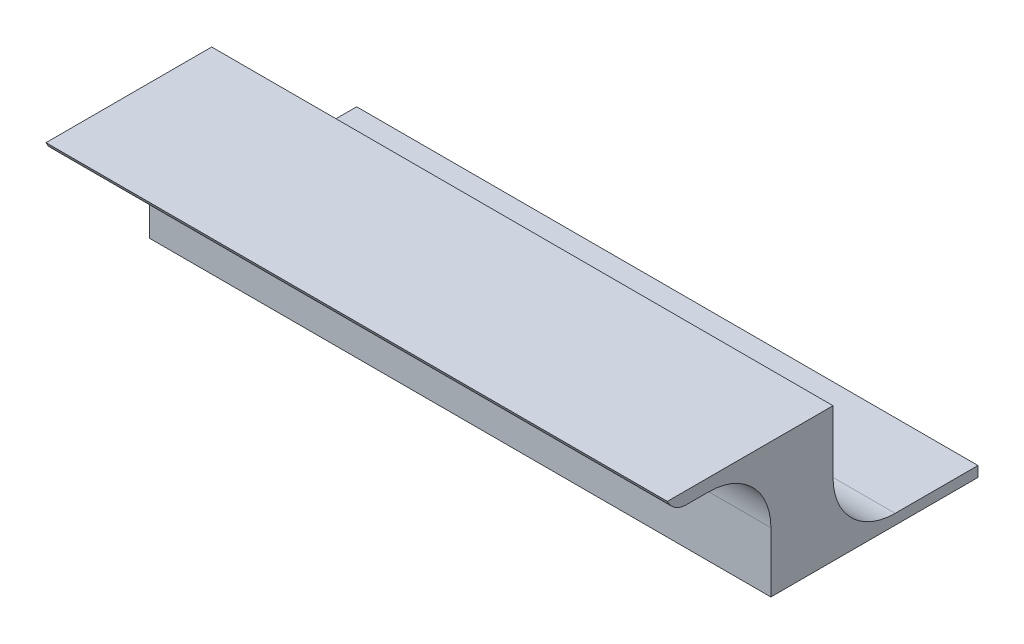
from build123d import *

# Parameters (mm, degrees)
SKETCH1_W           = 30
SKETCH1_H           = 10
BOSS_EXTRUDE1_DEPTH = 0.5
SKETCH2_W           = 30
SKETCH2_H           = 3
BOSS_EXTRUDE2_DEPTH = 6
SKETCH3_W           = 30
SKETCH3_H           = 0.6
BOSS_EXTRUDE3_DEPTH = 5
FILLET1_R           = 3
FILLET2_R           = 1


with BuildPart() as part:
    # Sketch1 → Boss-Extrude1 (new body)
    with BuildSketch(Plane(origin=(0, 0, 0), x_dir=(1, 0, 0), z_dir=(0, 1, 0))):
        Rectangle(SKETCH1_W, SKETCH1_H)
    extrude(amount=BOSS_EXTRUDE1_DEPTH)

    # Sketch2 → Boss-Extrude2 (add)
    with BuildSketch(Plane(origin=(0, 0.5, 0), x_dir=(1, 0, 0), z_dir=(0, 1, 0))):
        with Locations((0, -3.5)):
            Rectangle(SKETCH2_W, SKETCH2_H)
    extrude(amount=BOSS_EXTRUDE2_DEPTH)

    # Sketch3 → Boss-Extrude3 (add)
    with BuildSketch(Plane.XY.offset(5)):
        with Locations((0, 6.2)):
            Rectangle(SKETCH3_W, SKETCH3_H)
    extrude(amount=BOSS_EXTRUDE3_DEPTH)

    # Fillet1
    fillet1_edges = [part.edges().sort_by_distance(p)[0] for p in [
        (0, 0.5, 2),
        (0, 5.9, 5),
    ]]
    fillet(fillet1_edges, radius=FILLET1_R)

    # Fillet2
    # the kernel refuses this fillet: 1 mm, written as the material it takes off along each edge
    with BuildSketch(Plane(origin=(17.291287847, 5.9, 10), x_dir=(0, 0, -1), z_dir=(-1, 0, 0))) as fillet2_piece_1:
        with BuildLine():
            CenterArc((0.916515139, -1), FILLET2_R, 90, 66.421821522)
            Line((0, -0.6), (-0.018330303, -0.592))
            ThreePointArc((-0.018330303, -0.592), (-0.02, -0.3), (-0.02, 0))
            Line((-0.02, 0), (0, 0.02))
            Line((0, 0.02), (0.916515139, 0.02))
            Line((0.916515139, 0.02), (0.916515139, 0))
        make_face()
    extrude(amount=34.582575695, mode=Mode.SUBTRACT)


solid = part.part
